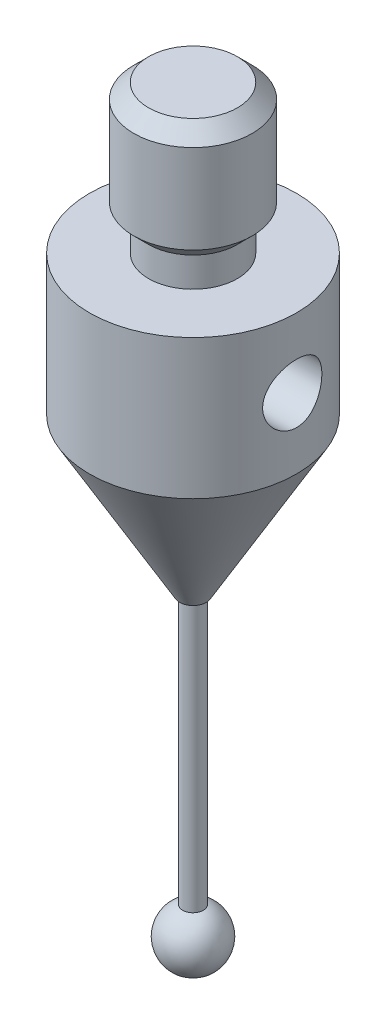
from build123d import *

# Parameters (mm, degrees)
SKETCH2_R               = 0.35
BOSS_EXTRUDE2_DEPTH     = 10
SKETCH4_R               = 3.5
BOSS_EXTRUDE3_DEPTH     = 10
CHAMFER1_SIZE           = 3.05
CHAMFER1_SIZE2          = 5.282754963
CUT_EXTRUDE4_DEPTH      = 21.603397778
CUT_EXTRUDE4_DEPTH_BACK = 21.603397778
SKETCH5_R               = 1
SKETCH6_R               = 1.5
BOSS_EXTRUDE4_DEPTH     = 1
SKETCH7_R               = 2
BOSS_EXTRUDE5_DEPTH     = 4
CHAMFER2_SIZE           = 0.5


with BuildPart() as part:
    # Sketch1 → Revolve1 (revolve)
    with BuildSketch(Plane.XY):
        with BuildLine():
            Line((0, 0), (0, -1))
            ThreePointArc((0, -1), (1, 0), (0, 1))
            Line((0, 1), (0, 0))
        make_face()
    revolve(axis=Axis((0, 0, 0), (0, 1, 0)))

    # Sketch2 → Boss-Extrude2 (add)
    with BuildSketch(Plane(origin=(0, 0, 0), x_dir=(1, 0, 0), z_dir=(0, 1, 0))):
        with Locations(Location((0, 0, 0), (0, 0, 90))):
            Circle(SKETCH2_R)
    extrude(amount=BOSS_EXTRUDE2_DEPTH)

    # Sketch4 → Boss-Extrude3 (add)
    with BuildSketch(Plane(origin=(0, 10, 0), x_dir=(1, 0, 0), z_dir=(0, 1, 0))):
        with Locations(Location((0, 0, 0), (0, 0, 270))):
            Circle(SKETCH4_R)
    extrude(amount=BOSS_EXTRUDE3_DEPTH)

    # Chamfer1
    chamfer1_edges = [part.edges().sort_by_distance(p)[0] for p in [
        (0, 10, -3.5),
    ]]
    chamfer1_side = [part.faces().sort_by_distance(p)[0] for p in [
        (0, 10, -3.401005051),
    ]]
    chamfer(chamfer1_edges, length=CHAMFER1_SIZE, length2=CHAMFER1_SIZE2, reference=chamfer1_side[0])

    # Sketch5 → Cut-Extrude4 (cut, two sides: drawn at the far end of the back side and taken through both)
    with BuildSketch(Plane(origin=(0, 0, 0), x_dir=(0, 0, -1), z_dir=(1, 0, 0)).offset(-CUT_EXTRUDE4_DEPTH_BACK)):
        with Locations((0, 17.641377482)):
            Circle(SKETCH5_R)
    extrude(amount=CUT_EXTRUDE4_DEPTH + CUT_EXTRUDE4_DEPTH_BACK, mode=Mode.SUBTRACT)

    # Sketch6 → Boss-Extrude4 (add)
    with BuildSketch(Plane(origin=(0, 20, 0), x_dir=(1, 0, 0), z_dir=(0, 1, 0))):
        with Locations(Location((0, 0, 0), (0, 0, 270))):
            Circle(SKETCH6_R)
    extrude(amount=BOSS_EXTRUDE4_DEPTH)

    # Sketch7 → Boss-Extrude5 (add)
    with BuildSketch(Plane(origin=(0, 21, 0), x_dir=(1, 0, 0), z_dir=(0, 1, 0))):
        with Locations(Location((0, 0, 0), (0, 0, 270))):
            Circle(SKETCH7_R)
    extrude(amount=BOSS_EXTRUDE5_DEPTH)

    # Chamfer2
    chamfer2_edges = [part.edges().sort_by_distance(p)[0] for p in [
        (0, 21, -2),
        (0, 25, -2),
    ]]
    chamfer(chamfer2_edges, length=CHAMFER2_SIZE - 0.0001)  # a hair under: the kernel refuses the full size


solid = part.part
